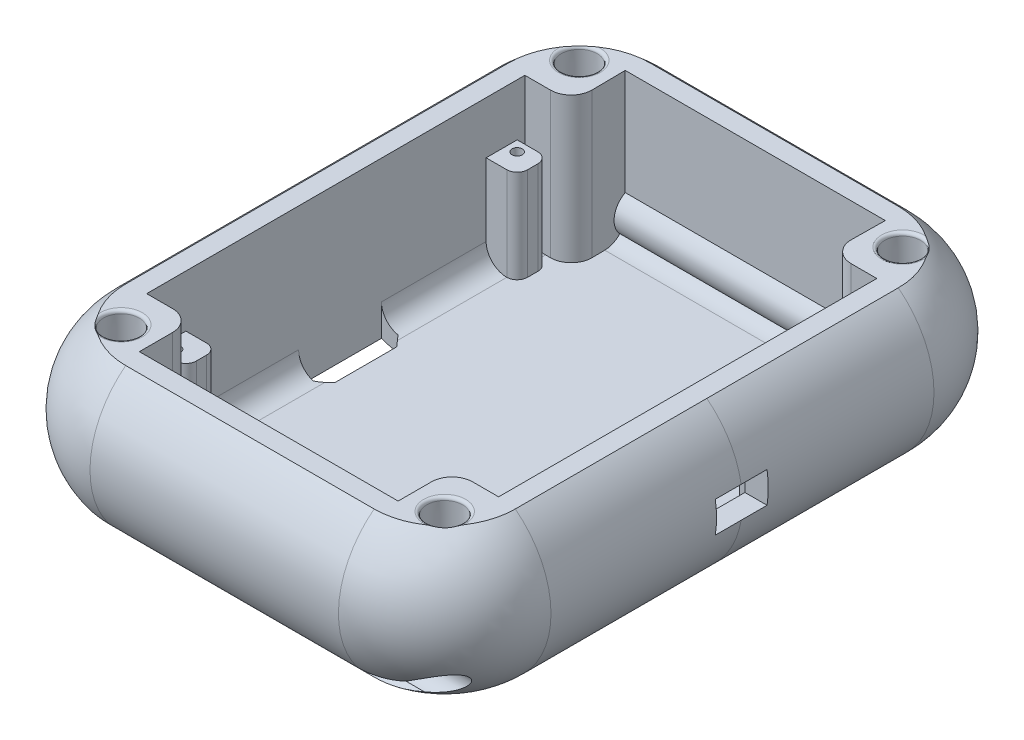
from build123d import *

# Parameters (mm, degrees)
BOSS_EXTRUDE1_DEPTH          = 8.5
FILLET1_R                    = 7
CUT_EXTRUDE1_DEPTH           = 38.357286747
CUT_EXTRUDE1_DEPTH_BACK      = 38.357286747
SKETCH6_W                    = 37.640973068
SKETCH6_H                    = 3.738596196
CUT_EXTRUDE2_DEPTH           = 14.032148533
FILLET4_R                    = 2
BOSS_EXTRUDE2_REACH          = 41.555
SKETCH11_R                   = 1.725
CUT_EXTRUDE3_DEPTH           = 9
CUT_EXTRUDE3_DRAFT           = 1
CUT_EXTRUDE3_PROFILE_2_DEPTH = 9
CUT_EXTRUDE3_PROFILE_2_DRAFT = 1
CUT_EXTRUDE3_PROFILE_3_DEPTH = 9
CUT_EXTRUDE3_PROFILE_3_DRAFT = 1
CUT_EXTRUDE3_PROFILE_4_DEPTH = 9
CUT_EXTRUDE3_PROFILE_4_DRAFT = 1
SKETCH13_W                   = 3
SKETCH13_H                   = 3
BOSS_EXTRUDE3_DEPTH          = 9
SKETCH14_R                   = 0.5
CUT_EXTRUDE4_DEPTH           = 7
CUT_EXTRUDE9_DEPTH           = 3
CUT_EXTRUDE9_DEPTH_BACK      = 39.989973924
CUT_EXTRUDE14_DEPTH          = 38.357286747
CUT_EXTRUDE14_DEPTH_BACK     = 38.357286747
SKETCH37_R                   = 1.5
FILLET20_R                   = 1
CUT_EXTRUDE15_DEPTH          = 38.357286747
CUT_EXTRUDE15_DEPTH_BACK     = 38.357286747
BOSS_EXTRUDE4_DEPTH          = 26
BOSS_EXTRUDE5_REACH          = 41.555
FILLET21_R                   = 2
FILLET22_R                   = 0.3
SKETCH41_W                   = 10
SKETCH41_H                   = 6
CUT_EXTRUDE16_DEPTH          = 3
SKETCH42_W                   = 5
SKETCH42_H                   = 3
CUT_EXTRUDE17_DEPTH          = 2.5
SKETCH48_W                   = 10
SKETCH48_H                   = 2.5
CUT_EXTRUDE18_DEPTH          = 3


with BuildPart() as part:
    # Sketch3 → Boss-Extrude1 (new, symmetric)
    with BuildSketch(Plane(origin=(0, 0, 0), x_dir=(1, 0, 0), z_dir=(0, 1, 0))):
        with BuildLine():
            Line((12, 22.5), (-12, 22.5))
            ThreePointArc((-12, 22.5), (-14.828427125, 21.328427125), (-16, 18.5))
            Line((-16, 18.5), (-16, -18.5))
            ThreePointArc((-16, -18.5), (-14.828427125, -21.328427125), (-12, -22.5))
            Line((-12, -22.5), (12, -22.5))
            ThreePointArc((12, -22.5), (14.828427125, -21.328427125), (16, -18.5))
            Line((16, -18.5), (16, 18.5))
            ThreePointArc((16, 18.5), (14.828427125, 21.328427125), (12, 22.5))
        make_face()
    extrude(amount=BOSS_EXTRUDE1_DEPTH, both=True)

    # Sweep1: sweep along a path in Sketch4
    with BuildLine(Plane(origin=(0, 0, 0), x_dir=(1, 0, 0), z_dir=(0, 1, 0))) as sweep1_path:
        Line((12, 22.5), (-12, 22.5))
        ThreePointArc((-12, 22.5), (-14.828427125, 21.328427125), (-16, 18.5))
        Line((-16, 18.5), (-16, -18.5))
        ThreePointArc((-16, -18.5), (-14.828427125, -21.328427125), (-12, -22.5))
        Line((-12, -22.5), (12, -22.5))
        ThreePointArc((12, -22.5), (14.828427125, -21.328427125), (16, -18.5))
        Line((16, -18.5), (16, 18.5))
        ThreePointArc((16, 18.5), (14.828427125, 21.328427125), (12, 22.5))
    # Sketch5 → Sweep1 (sweep)
    with BuildSketch(Plane.XY):
        with BuildLine():
            Line((16, 8.5), (16, -8.5))
            ThreePointArc((16, -8.5), (22.266581483, 0), (16, 8.5))
        make_face()
    sweep(path=sweep1_path.line)

    # Fillet1
    fillet1_edges = [part.edges().sort_by_distance(p)[0] for p in [
        (0, -8.5, 22.5),
        (-14.828427125, -8.5, 21.328427125),
        (-16, -8.5, 0),
        (-14.828427125, -8.5, -21.328427125),
        (-14.828427125, 8.5, 21.328427125),
        (0, 8.5, 22.5),
        (14.828427125, 8.5, 21.328427125),
        (16, 8.5, 0),
        (16, -8.5, 0),
        (14.828427125, 8.5, -21.328427125),
        (16, 8.5, 0),
        (0, 8.5, -22.5),
        (-14.828427125, 8.5, -21.328427125),
        (0, -8.5, -22.5),
        (-16, 8.5, 0),
        (14.828427125, -8.5, -21.328427125),
        (16, -8.5, 0),
        (14.828427125, -8.5, 21.328427125),
    ]]
    fillet(fillet1_edges, radius=FILLET1_R)

    # Sketch6 → Cut-Extrude1 (cut, two sides: drawn at the far end of the back side and taken through both)
    with BuildSketch(Plane.XY.offset(-CUT_EXTRUDE1_DEPTH_BACK)):
        with Locations((0, 8.901446631)):
            Rectangle(SKETCH6_W, SKETCH6_H)
    extrude(amount=CUT_EXTRUDE1_DEPTH + CUT_EXTRUDE1_DEPTH_BACK, mode=Mode.SUBTRACT)

    # Sketch7 → Cut-Extrude2 (cut)
    with BuildSketch(Plane(origin=(0, 7.032148533, 0), x_dir=(1, 0, 0), z_dir=(0, 1, 0))):
        with BuildLine():
            Line((13, 23.5), (-13, 23.5))
            ThreePointArc((-13, 23.5), (-15.828427125, 22.328427125), (-17, 19.5))
            Line((-17, 19.5), (-17, -19.5))
            ThreePointArc((-17, -19.5), (-15.828427125, -22.328427125), (-13, -23.5))
            Line((-13, -23.5), (13, -23.5))
            ThreePointArc((13, -23.5), (15.828427125, -22.328427125), (17, -19.5))
            Line((17, -19.5), (17, 19.5))
            ThreePointArc((17, 19.5), (15.828427125, 22.328427125), (13, 23.5))
        make_face()
    extrude(amount=-CUT_EXTRUDE2_DEPTH, mode=Mode.SUBTRACT)

    # Fillet4
    fillet4_edges = [part.edges().sort_by_distance(p)[0] for p in [
        (-15.828427125, -7, -22.328427125),
        (0, -7, -23.5),
        (15.828427125, -7, -22.328427125),
        (17, -7, 0),
        (15.828427125, -7, 22.328427125),
        (0, -7, 23.5),
        (-15.828427125, -7, 22.328427125),
        (-17, -7, 0),
    ]]
    fillet(fillet4_edges, radius=FILLET4_R)

    # Boss-Extrude2: up to this face of the body (flat: up to its plane)
    boss_extrude2_end = Plane(part.part.faces().sort_by_distance((0, -7, 0))[0])
    # Sketch9 → Boss-Extrude2 (add, up to the picked face)
    with BuildSketch(Plane(origin=(0, 7.032148533, 0), x_dir=(1, 0, 0), z_dir=(0, 1, 0)), mode=Mode.PRIVATE) as boss_extrude2_sk1:
        with BuildLine():
            Line((-17, 19.5), (-13, 19.5))
            Line((-13, 19.5), (-13, 23.5))
            ThreePointArc((-13, 23.5), (-15.828427125, 22.328427125), (-17, 19.5))
        make_face()
    boss_extrude2_tool1 = split(extrude(boss_extrude2_sk1.sketch, amount=-BOSS_EXTRUDE2_REACH, mode=Mode.PRIVATE), bisect_by=boss_extrude2_end, keep=Keep.BOTH, mode=Mode.PRIVATE)
    # Sketch9 → Boss-Extrude2 (add, up to the picked face)
    with BuildSketch(Plane(origin=(0, 7.032148533, 0), x_dir=(1, 0, 0), z_dir=(0, 1, 0)), mode=Mode.PRIVATE) as boss_extrude2_sk2:
        with BuildLine():
            Line((-17, -19.5), (-13, -19.5))
            Line((-13, -19.5), (-13, -23.5))
            ThreePointArc((-13, -23.5), (-15.828427125, -22.328427125), (-17, -19.5))
        make_face()
    boss_extrude2_tool2 = split(extrude(boss_extrude2_sk2.sketch, amount=-BOSS_EXTRUDE2_REACH, mode=Mode.PRIVATE), bisect_by=boss_extrude2_end, keep=Keep.BOTH, mode=Mode.PRIVATE)
    # Sketch9 → Boss-Extrude2 (add, up to the picked face)
    with BuildSketch(Plane(origin=(0, 7.032148533, 0), x_dir=(1, 0, 0), z_dir=(0, 1, 0)), mode=Mode.PRIVATE) as boss_extrude2_sk3:
        with BuildLine():
            Line((13, 23.5), (13, 19.5))
            Line((13, 19.5), (17, 19.5))
            ThreePointArc((17, 19.5), (15.828427125, 22.328427125), (13, 23.5))
        make_face()
    boss_extrude2_tool3 = split(extrude(boss_extrude2_sk3.sketch, amount=-BOSS_EXTRUDE2_REACH, mode=Mode.PRIVATE), bisect_by=boss_extrude2_end, keep=Keep.BOTH, mode=Mode.PRIVATE)
    # Sketch9 → Boss-Extrude2 (add, up to the picked face)
    with BuildSketch(Plane(origin=(0, 7.032148533, 0), x_dir=(1, 0, 0), z_dir=(0, 1, 0)), mode=Mode.PRIVATE) as boss_extrude2_sk4:
        with BuildLine():
            Line((13, -23.5), (13, -19.5))
            Line((13, -19.5), (17, -19.5))
            ThreePointArc((17, -19.5), (15.828427125, -22.328427125), (13, -23.5))
        make_face()
    boss_extrude2_tool4 = split(extrude(boss_extrude2_sk4.sketch, amount=-BOSS_EXTRUDE2_REACH, mode=Mode.PRIVATE), bisect_by=boss_extrude2_end, keep=Keep.BOTH, mode=Mode.PRIVATE)
    add(boss_extrude2_tool1.solids().sort_by(Axis((-14.697653, 7.032149, -21.197653), (0, -1, 0)))[0])
    add(boss_extrude2_tool2.solids().sort_by(Axis((-14.697653, 7.032149, 21.197653), (0, -1, 0)))[0])
    add(boss_extrude2_tool3.solids().sort_by(Axis((14.697653, 7.032149, -21.197653), (0, -1, 0)))[0])
    add(boss_extrude2_tool4.solids().sort_by(Axis((14.697653, 7.032149, 21.197653), (0, -1, 0)))[0])


with BuildPart() as cut_extrude3_tool:
    # Sketch11 → Cut-Extrude3 (with draft: the straight prism first)
    with BuildSketch(Plane(origin=(0, 7.032148533, 0), x_dir=(1, 0, 0), z_dir=(0, 1, 0))):
        with Locations((-15.620486534, -22.120486534)):
            Circle(SKETCH11_R)
    extrude(amount=-CUT_EXTRUDE3_DEPTH)
    # Cut-Extrude3: the draft: its side faces are tilted about the plane it starts from
    cut_extrude3_sides = [cut_extrude3_tool.faces().sort_by_distance(p)[0] for p in [
        (-17.345486534, 2.532148533, 22.120486534),
    ]]
    draft(cut_extrude3_sides, Plane(origin=(0, 7.032148533, 0), x_dir=(1, 0, 0), z_dir=(0, 1, 0)), CUT_EXTRUDE3_DRAFT)


with BuildPart() as part_1:
    add(part.part)

    # Cut-Extrude3: cut by cut_extrude3_tool
    add(cut_extrude3_tool.part, mode=Mode.SUBTRACT)


with BuildPart() as cut_extrude3_profile_2_tool:
    # Sketch11 → Cut-Extrude3 profile 2 (with draft: the straight prism first)
    with BuildSketch(Plane(origin=(0, 7.032148533, 0), x_dir=(1, 0, 0), z_dir=(0, 1, 0))):
        with Locations((15.620486534, -22.120486534)):
            Circle(SKETCH11_R)
    extrude(amount=-CUT_EXTRUDE3_PROFILE_2_DEPTH)
    # Cut-Extrude3 profile 2: the draft: its side faces are tilted about the plane it starts from
    cut_extrude3_profile_2_sides = [cut_extrude3_profile_2_tool.faces().sort_by_distance(p)[0] for p in [
        (13.895486534, 2.532148533, 22.120486534),
    ]]
    draft(cut_extrude3_profile_2_sides, Plane(origin=(0, 7.032148533, 0), x_dir=(1, 0, 0), z_dir=(0, 1, 0)), CUT_EXTRUDE3_PROFILE_2_DRAFT)


with BuildPart() as part_2:
    add(part_1.part)

    # Cut-Extrude3 profile 2: cut by cut_extrude3_profile_2_tool
    add(cut_extrude3_profile_2_tool.part, mode=Mode.SUBTRACT)


with BuildPart() as cut_extrude3_profile_3_tool:
    # Sketch11 → Cut-Extrude3 profile 3 (with draft: the straight prism first)
    with BuildSketch(Plane(origin=(0, 7.032148533, 0), x_dir=(1, 0, 0), z_dir=(0, 1, 0))):
        with Locations((-15.620486534, 22.120486534)):
            Circle(SKETCH11_R)
    extrude(amount=-CUT_EXTRUDE3_PROFILE_3_DEPTH)
    # Cut-Extrude3 profile 3: the draft: its side faces are tilted about the plane it starts from
    cut_extrude3_profile_3_sides = [cut_extrude3_profile_3_tool.faces().sort_by_distance(p)[0] for p in [
        (-17.345486534, 2.532148533, -22.120486534),
    ]]
    draft(cut_extrude3_profile_3_sides, Plane(origin=(0, 7.032148533, 0), x_dir=(1, 0, 0), z_dir=(0, 1, 0)), CUT_EXTRUDE3_PROFILE_3_DRAFT)


with BuildPart() as part_3:
    add(part_2.part)

    # Cut-Extrude3 profile 3: cut by cut_extrude3_profile_3_tool
    add(cut_extrude3_profile_3_tool.part, mode=Mode.SUBTRACT)


with BuildPart() as cut_extrude3_profile_4_tool:
    # Sketch11 → Cut-Extrude3 profile 4 (with draft: the straight prism first)
    with BuildSketch(Plane(origin=(0, 7.032148533, 0), x_dir=(1, 0, 0), z_dir=(0, 1, 0))):
        with Locations((15.620486534, 22.120486534)):
            Circle(SKETCH11_R)
    extrude(amount=-CUT_EXTRUDE3_PROFILE_4_DEPTH)
    # Cut-Extrude3 profile 4: the draft: its side faces are tilted about the plane it starts from
    cut_extrude3_profile_4_sides = [cut_extrude3_profile_4_tool.faces().sort_by_distance(p)[0] for p in [
        (13.895486534, 2.532148533, -22.120486534),
    ]]
    draft(cut_extrude3_profile_4_sides, Plane(origin=(0, 7.032148533, 0), x_dir=(1, 0, 0), z_dir=(0, 1, 0)), CUT_EXTRUDE3_PROFILE_4_DRAFT)


with BuildPart() as part_4:
    add(part_3.part)

    # Cut-Extrude3 profile 4: cut by cut_extrude3_profile_4_tool
    add(cut_extrude3_profile_4_tool.part, mode=Mode.SUBTRACT)

    # Sketch13 → Boss-Extrude3 (add)
    with BuildSketch(Plane(origin=(0, -7, 0), x_dir=(1, 0, 0), z_dir=(0, 1, 0))):
        with Locations((-15.5, -16)):
            Rectangle(SKETCH13_W, SKETCH13_H)
        with Locations((-15.5, 16)):
            Rectangle(SKETCH13_W, SKETCH13_H)
        with Locations((15.5, 16)):
            Rectangle(SKETCH13_W, SKETCH13_H)
        with Locations((15.5, -16)):
            Rectangle(SKETCH13_W, SKETCH13_H)
    extrude(amount=BOSS_EXTRUDE3_DEPTH)

    # Sketch14 → Cut-Extrude4 (cut)
    with BuildSketch(Plane(origin=(0, 2, 0), x_dir=(1, 0, 0), z_dir=(0, 1, 0))):
        with Locations(Location((-16, 16.5, 0), (0, 0, 270))):
            Circle(SKETCH14_R)
        with Locations(Location((-16, -16.5, 0), (0, 0, 270))):
            Circle(SKETCH14_R)
        with Locations(Location((16, -16.5, 0), (0, 0, 270))):
            Circle(SKETCH14_R)
        with Locations(Location((16, 16.5, 0), (0, 0, 270))):
            Circle(SKETCH14_R)
    extrude(amount=-CUT_EXTRUDE4_DEPTH, mode=Mode.SUBTRACT)

    # Sketch28 → Cut-Extrude9 (cut, two sides: drawn at the far end of the back side and taken through both)
    with BuildSketch(Plane(origin=(0, -7, 0), x_dir=(1, 0, 0), z_dir=(0, 1, 0)).offset(-CUT_EXTRUDE9_DEPTH_BACK)):
        Polygon((-17, 4.387797516), (-17, -3.612202484), (-15.606693262, -3.612202484), (-14.5, -2.639296791), (-14.5, 3.360703209), (-15.400410733, 4.387797516), align=None)
    extrude(amount=CUT_EXTRUDE9_DEPTH + CUT_EXTRUDE9_DEPTH_BACK, mode=Mode.SUBTRACT)

    # Sketch37 → Cut-Extrude14 (cut, two sides: drawn at the far end of the back side and taken through both)
    with BuildSketch(Plane(origin=(0, 0, 0), x_dir=(0, 0, -1), z_dir=(1, 0, 0)).offset(-CUT_EXTRUDE14_DEPTH_BACK)):
        with Locations(Location((24.858436735, -5.034970269, 0), (0, 0, 313.556549474))):
            Circle(SKETCH37_R)
        with Locations(Location((-24.858436735, -5.034970269, 0), (0, 0, 37.479968451))):
            Circle(SKETCH37_R)
    extrude(amount=CUT_EXTRUDE14_DEPTH + CUT_EXTRUDE14_DEPTH_BACK, mode=Mode.SUBTRACT)

    # Fillet20
    fillet20_edges = [part_4.edges().sort_by_distance(p)[0] for p in [
        (14, -2.5, -14.5),
        (14, -2.5, -17.5),
        (14, -2.5, 17.5),
        (14, -2.5, 14.5),
        (-14, -2.5, -14.5),
        (-14, -2.5, -17.5),
        (-14, -2.5, 17.5),
        (-14, -2.5, 14.5),
        (13, 0.016074267, 19.5),
        (13, 0.016074267, -19.5),
        (-13, 0.016074267, 19.5),
        (-13, 0.016074267, -19.5),
    ]]
    fillet(fillet20_edges, radius=FILLET20_R)

    # Sketch38 → Cut-Extrude15 (cut, two sides: drawn at the far end of the back side and taken through both)
    with BuildSketch(Plane(origin=(0, 0, 0), x_dir=(0, 0, -1), z_dir=(1, 0, 0)).offset(-CUT_EXTRUDE15_DEPTH_BACK)):
        Polygon((24.638941083, -6.51882392), (26.342290386, -4.815474616), (27.257709792, -5.730894022), (25.668043841, -7.320559973), align=None)
        Polygon((-25.668043841, -7.320559973), (-24.638941083, -6.51882392), (-26.342290386, -4.815474616), (-27.257709792, -5.730894022), align=None)
    extrude(amount=CUT_EXTRUDE15_DEPTH + CUT_EXTRUDE15_DEPTH_BACK, mode=Mode.SUBTRACT)

    # Sketch39 → Boss-Extrude4 (add)
    with BuildSketch(Plane(origin=(-13, 0, 0), x_dir=(0, 0, -1), z_dir=(1, 0, 0))):
        with BuildLine():
            Line((23.5, -4.398849496), (23.5, -3.19339184))
            ThreePointArc((23.5, -3.19339184), (22.437390475, -4.641540143), (22.96895644, -6.35726452))
            ThreePointArc((22.96895644, -6.35726452), (23.254099934, -5.960798326), (23.434658615, -5.507046391))
            ThreePointArc((23.434658615, -5.507046391), (23.361037335, -4.946680768), (23.5, -4.398849496))
        make_face()
        with BuildLine():
            Line((-23.5, -4.398849496), (-23.5, -3.19339184))
            ThreePointArc((-23.5, -3.19339184), (-22.437390475, -4.641540143), (-22.96895644, -6.35726452))
            ThreePointArc((-22.96895644, -6.35726452), (-23.254099934, -5.960798326), (-23.434658615, -5.507046391))
            ThreePointArc((-23.434658615, -5.507046391), (-23.361037335, -4.946680768), (-23.5, -4.398849496))
        make_face()
    extrude(amount=BOSS_EXTRUDE4_DEPTH)

    # Boss-Extrude5: up to this face of the body (flat: up to its plane)
    boss_extrude5_end = Plane(part_4.part.faces().sort_by_distance((0.038051369, -7, 0.001016615))[0])
    # Sketch40 → Boss-Extrude5 (add, up to the picked face)
    with BuildSketch(Plane(origin=(0, 7.032148533, 0), x_dir=(1, 0, 0), z_dir=(0, 1, 0)), mode=Mode.PRIVATE) as boss_extrude5_sk1:
        with BuildLine():
            Line((-17, 19.5), (-14, 19.5))
            ThreePointArc((-14, 19.5), (-13.292893219, 19.792893219), (-13, 20.5))
            Line((-13, 20.5), (-13, 23.5))
            Line((-13, 23.5), (-12.562362465, 23.5))
            Line((-12.562362465, 23.5), (-12.5, 18.243330831))
            Line((-12.5, 18.243330831), (-17, 18.243330831))
            Line((-17, 18.243330831), (-17, 19.5))
        make_face()
    boss_extrude5_tool1 = split(extrude(boss_extrude5_sk1.sketch, amount=-BOSS_EXTRUDE5_REACH, mode=Mode.PRIVATE), bisect_by=boss_extrude5_end, keep=Keep.BOTH, mode=Mode.PRIVATE)
    # Sketch40 → Boss-Extrude5 (add, up to the picked face)
    with BuildSketch(Plane(origin=(0, 7.032148533, 0), x_dir=(1, 0, 0), z_dir=(0, 1, 0)), mode=Mode.PRIVATE) as boss_extrude5_sk2:
        with BuildLine():
            Line((-17, -19.5), (-14, -19.5))
            ThreePointArc((-14, -19.5), (-13.292893219, -19.792893219), (-13, -20.5))
            Line((-13, -20.5), (-13, -23.5))
            Line((-13, -23.5), (-12.5, -23.5))
            Line((-12.5, -23.5), (-12.5, -18.292945066))
            Line((-12.5, -18.292945066), (-17, -18.292945066))
            Line((-17, -18.292945066), (-17, -19.5))
        make_face()
    boss_extrude5_tool2 = split(extrude(boss_extrude5_sk2.sketch, amount=-BOSS_EXTRUDE5_REACH, mode=Mode.PRIVATE), bisect_by=boss_extrude5_end, keep=Keep.BOTH, mode=Mode.PRIVATE)
    # Sketch40 → Boss-Extrude5 (add, up to the picked face)
    with BuildSketch(Plane(origin=(0, 7.032148533, 0), x_dir=(1, 0, 0), z_dir=(0, 1, 0)), mode=Mode.PRIVATE) as boss_extrude5_sk3:
        with BuildLine():
            Line((12.5, 18.243330831), (17, 18.243330831))
            Line((17, 18.243330831), (17, 19.5))
            Line((17, 19.5), (14, 19.5))
            ThreePointArc((14, 19.5), (13.292893219, 19.792893219), (13, 20.5))
            Line((13, 20.5), (13, 23.5))
            Line((13, 23.5), (12.562362465, 23.5))
            Line((12.562362465, 23.5), (12.5, 18.243330831))
        make_face()
    boss_extrude5_tool3 = split(extrude(boss_extrude5_sk3.sketch, amount=-BOSS_EXTRUDE5_REACH, mode=Mode.PRIVATE), bisect_by=boss_extrude5_end, keep=Keep.BOTH, mode=Mode.PRIVATE)
    # Sketch40 → Boss-Extrude5 (add, up to the picked face)
    with BuildSketch(Plane(origin=(0, 7.032148533, 0), x_dir=(1, 0, 0), z_dir=(0, 1, 0)), mode=Mode.PRIVATE) as boss_extrude5_sk4:
        with BuildLine():
            Line((12.5, -18.292945066), (17, -18.292945066))
            Line((17, -18.292945066), (17, -19.5))
            Line((17, -19.5), (14, -19.5))
            ThreePointArc((14, -19.5), (13.292893219, -19.792893219), (13, -20.5))
            Line((13, -20.5), (13, -23.5))
            Line((13, -23.5), (12.5, -23.5))
            Line((12.5, -23.5), (12.5, -18.292945066))
        make_face()
    boss_extrude5_tool4 = split(extrude(boss_extrude5_sk4.sketch, amount=-BOSS_EXTRUDE5_REACH, mode=Mode.PRIVATE), bisect_by=boss_extrude5_end, keep=Keep.BOTH, mode=Mode.PRIVATE)
    add(boss_extrude5_tool1.solids().sort_by(Axis((-15.5, 7.032149, -19.430803), (0, -1, 0)))[0])
    add(boss_extrude5_tool2.solids().sort_by(Axis((-15.5, 7.032149, 19.431179), (0, -1, 0)))[0])
    add(boss_extrude5_tool3.solids().sort_by(Axis((14.75, 7.032149, -18.312528), (0, -1, 0)))[0])
    add(boss_extrude5_tool4.solids().sort_by(Axis((14.75, 7.032149, 18.361766), (0, -1, 0)))[0])

    # Fillet21
    fillet21_edges = [part_4.edges().sort_by_distance(p)[0] for p in [
        (-12.5, 0.016074267, -18.243330831),
        (-12.5, 0.016074267, 18.292945066),
        (12.5, 0.016074267, -18.243330831),
        (12.5, 0.016074267, 18.292945066),
    ]]
    fillet(fillet21_edges, radius=FILLET21_R)

    # Fillet22
    # the kernel refuses this fillet: 0.3 mm, written as the material it takes off along each edge
    with BuildSketch(Plane(origin=(-15.620486534, 7.032148533, 22.120486534), x_dir=(1, 0, 0), z_dir=(0, 0, 1))) as fillet22_piece_1:
        with BuildLine():
            CenterArc((1.725 + FILLET22_R * 1.01760739297, -FILLET22_R), FILLET22_R, 90, 91)
            Line((1.725 + FILLET22_R * 0.0177596978157, -FILLET22_R * 1.01745240644), (1.725, 0))
            Line((1.725, 0), (1.725 + FILLET22_R * 1.01760739297, 0))
        make_face()
    revolve(axis=Axis((-15.620486534, 7.032148533, 22.120486534), (0, 1, 0)), revolution_arc=239.198822298, mode=Mode.SUBTRACT)
    with BuildSketch(Plane(origin=(-15.620486534, 7.032148533, -22.120486534), x_dir=(-0.5120605204986656, 0, -0.8589493718180575), z_dir=(0.8589493718180575, 0, -0.5120605204986656))) as fillet22_piece_2:
        with BuildLine():
            CenterArc((1.725 + FILLET22_R * 1.01760739297, -FILLET22_R), FILLET22_R, 90, 91)
            Line((1.725 + FILLET22_R * 0.0177596978157, -FILLET22_R * 1.01745240644), (1.725, 0))
            Line((1.725, 0), (1.725 + FILLET22_R * 1.01760739297, 0))
        make_face()
    revolve(axis=Axis((-15.620486534, 7.032148533, -22.120486534), (0, 1, 0)), revolution_arc=239.198822298, mode=Mode.SUBTRACT)
    with BuildSketch(Plane(origin=(15.620486534, 7.032148533, -22.120486534), x_dir=(0.8594746718507895, 0, -0.5111783333113578), z_dir=(0.5111783333113578, 0, 0.8594746718507895))) as fillet22_piece_3:
        with BuildLine():
            CenterArc((1.725 + FILLET22_R * 1.01760739297, -FILLET22_R), FILLET22_R, 90, 91)
            Line((1.725 + FILLET22_R * 0.0177596978157, -FILLET22_R * 1.01745240644), (1.725, 0))
            Line((1.725, 0), (1.725 + FILLET22_R * 1.01760739297, 0))
        make_face()
    revolve(axis=Axis((15.620486534, 7.032148533, -22.120486534), (0, 1, 0)), revolution_arc=329.25765015, mode=Mode.SUBTRACT)
    with BuildSketch(Plane(origin=(15.620486534, 7.032148533, 22.120486534), x_dir=(1, 0, 0), z_dir=(0, 0, 1))) as fillet22_piece_4:
        with BuildLine():
            CenterArc((1.725 + FILLET22_R * 1.01760739297, -FILLET22_R), FILLET22_R, 90, 91)
            Line((1.725 + FILLET22_R * 0.0177596978157, -FILLET22_R * 1.01745240644), (1.725, 0))
            Line((1.725, 0), (1.725 + FILLET22_R * 1.01760739297, 0))
        make_face()
    revolve(axis=Axis((15.620486534, 7.032148533, 22.120486534), (0, 1, 0)), revolution_arc=329.25765015, mode=Mode.SUBTRACT)
    with BuildSketch(Plane(origin=(15.620486534, 7.032148533, 22.120486534), x_dir=(0.5129013276657719, 0, 0.8584475686252997), z_dir=(-0.8584475686252997, 0, 0.5129013276657719))) as fillet22_piece_5:
        with BuildLine():
            CenterArc((1.725 + FILLET22_R * 1.01760739297, -FILLET22_R), FILLET22_R, 90, 91)
            Line((1.725 + FILLET22_R * 0.0177596978157, -FILLET22_R * 1.01745240644), (1.725, 0))
            Line((1.725, 0), (1.725 + FILLET22_R * 1.01760739297, 0))
        make_face()
    revolve(axis=Axis((15.620486534, 7.032148533, 22.120486534), (0, 1, 0)), revolution_arc=59.142720301, mode=Mode.SUBTRACT)
    with BuildSketch(Plane(origin=(15.620486534, 7.032148533, -22.120486534), x_dir=(1, 0, 0), z_dir=(0, 0, 1))) as fillet22_piece_6:
        with BuildLine():
            CenterArc((1.725 + FILLET22_R * 1.01760739297, -FILLET22_R), FILLET22_R, 90, 91)
            Line((1.725 + FILLET22_R * 0.0177596978157, -FILLET22_R * 1.01745240644), (1.725, 0))
            Line((1.725, 0), (1.725 + FILLET22_R * 1.01760739297, 0))
        make_face()
    revolve(axis=Axis((15.620486534, 7.032148533, -22.120486534), (0, 1, 0)), revolution_arc=59.142720301, mode=Mode.SUBTRACT)
    with BuildSketch(Plane(origin=(-15.620486534, 7.032148533, -22.120486534), x_dir=(1, 0, 0), z_dir=(0, 0, 1))) as fillet22_piece_7:
        with BuildLine():
            CenterArc((1.725 + FILLET22_R * 1.01760739297, -FILLET22_R), FILLET22_R, 90, 91)
            Line((1.725 + FILLET22_R * 0.0177596978157, -FILLET22_R * 1.01745240644), (1.725, 0))
            Line((1.725, 0), (1.725 + FILLET22_R * 1.01760739297, 0))
        make_face()
    revolve(axis=Axis((-15.620486534, 7.032148533, -22.120486534), (0, 1, 0)), revolution_arc=149.16055552, mode=Mode.SUBTRACT)
    with BuildSketch(Plane(origin=(-15.620486534, 7.032148533, 22.120486534), x_dir=(-0.8586071846448909, 0, 0.5126340824371456), z_dir=(-0.5126340824371456, 0, -0.8586071846448909))) as fillet22_piece_8:
        with BuildLine():
            CenterArc((1.725 + FILLET22_R * 1.01760739297, -FILLET22_R), FILLET22_R, 90, 91)
            Line((1.725 + FILLET22_R * 0.0177596978157, -FILLET22_R * 1.01745240644), (1.725, 0))
            Line((1.725, 0), (1.725 + FILLET22_R * 1.01760739297, 0))
        make_face()
    revolve(axis=Axis((-15.620486534, 7.032148533, 22.120486534), (0, 1, 0)), revolution_arc=149.16055552, mode=Mode.SUBTRACT)

    # Sketch41 → Cut-Extrude16 (cut)
    with BuildSketch(Plane.ZY.offset(-17)):
        Rectangle(SKETCH41_W, SKETCH41_H)
    extrude(amount=-CUT_EXTRUDE16_DEPTH, mode=Mode.SUBTRACT)

    # Sketch42 → Cut-Extrude17 (cut)
    with BuildSketch(Plane.ZY.offset(-20)):
        Rectangle(SKETCH42_W, SKETCH42_H)
    extrude(amount=-CUT_EXTRUDE17_DEPTH, mode=Mode.SUBTRACT)

    # Sketch48 → Cut-Extrude18 (cut)
    with BuildSketch(Plane.ZY.offset(-17)):
        with Locations((0, -4.25)):
            Rectangle(SKETCH48_W, SKETCH48_H)
    extrude(amount=-CUT_EXTRUDE18_DEPTH, mode=Mode.SUBTRACT)


solid = part_4.part
